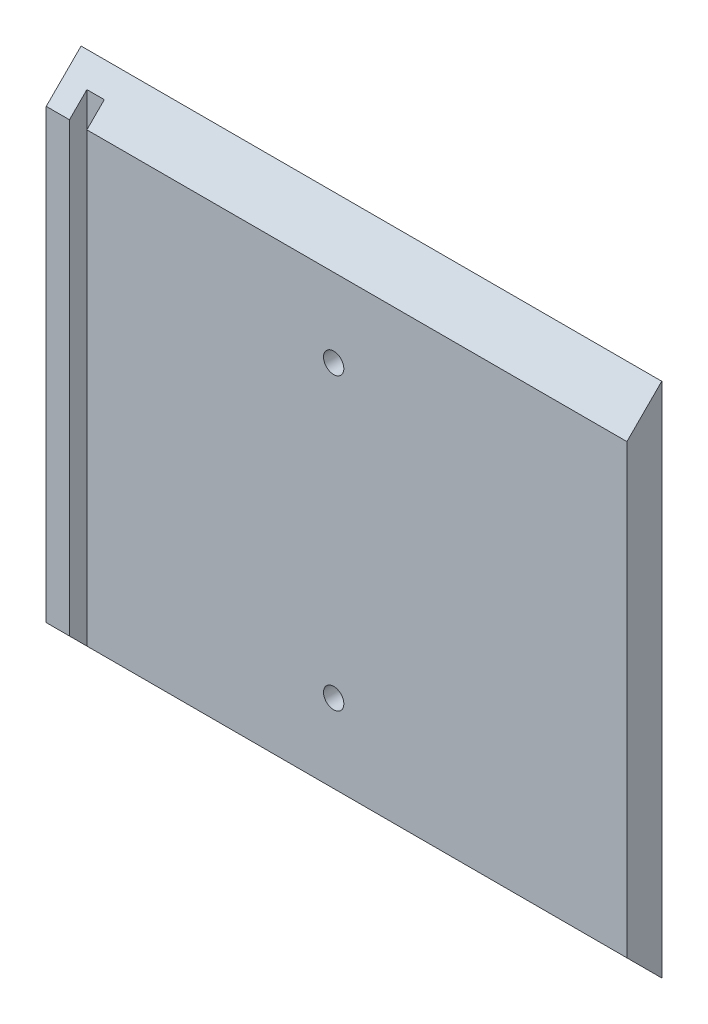
from build123d import *

# Parameters (mm, degrees)
SKETCH1_W           = 100
SKETCH1_H           = 89
BOSS_EXTRUDE1_DEPTH = 6
CHAMFER1_SIZE       = 6
SKETCH2_W           = 3
SKETCH2_H           = 89
CUT_EXTRUDE1_DEPTH  = 3
SKETCH4_R           = 1.75
CUT_EXTRUDE3_DEPTH  = 68.203050526


with BuildPart() as part:
    # Sketch1 → Boss-Extrude1 (new body)
    with BuildSketch(Plane.XY):
        Rectangle(SKETCH1_W, SKETCH1_H)
    extrude(amount=BOSS_EXTRUDE1_DEPTH)

    # Chamfer1
    chamfer1_edges = [part.edges().sort_by_distance(p)[0] for p in [
        (0, -44.5, 6),
        (0, 44.5, 6),
    ]]
    chamfer(chamfer1_edges, length=CHAMFER1_SIZE - 0.0001)  # a hair under: the kernel refuses the full size

    # Sketch2 → Cut-Extrude1 (cut)
    with BuildSketch(Plane.XY.offset(6)):
        with Locations((-44.5, 0)):
            Rectangle(SKETCH2_W, SKETCH2_H)
    extrude(amount=-CUT_EXTRUDE1_DEPTH, mode=Mode.SUBTRACT)

    # Sketch4 → Cut-Extrude3 (cut, through all)
    with BuildSketch(Plane(origin=(0, 0, 0), x_dir=(-1, 0, 0), z_dir=(0, 0, -1))):
        with Locations((0.5, 25)):
            Circle(SKETCH4_R)
        with Locations((0.5, -25)):
            Circle(SKETCH4_R)
    extrude(amount=-CUT_EXTRUDE3_DEPTH, mode=Mode.SUBTRACT)


solid = part.part
